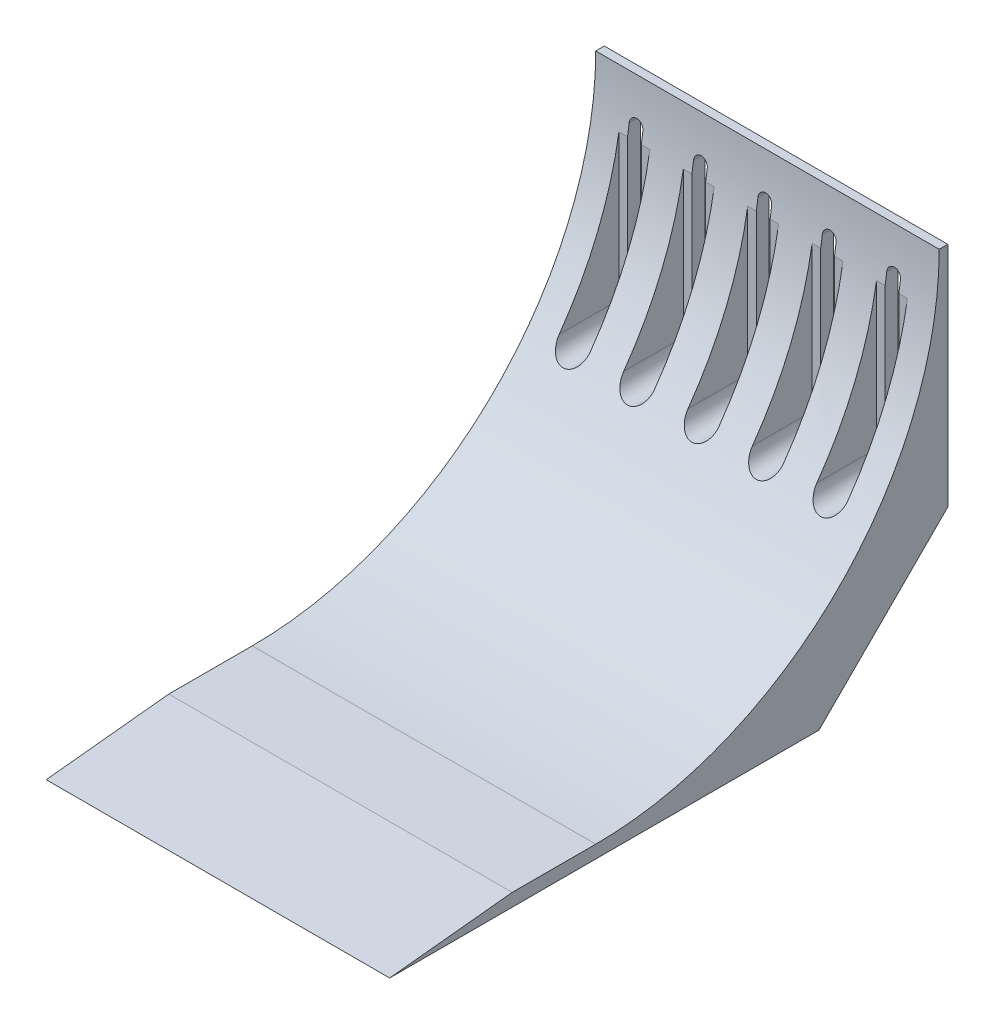
from build123d import *

# Parameters (mm, degrees)
SKETCH1_W           = 80
SKETCH1_H           = 130
BOSS_EXTRUDE1_DEPTH = 3
SKETCH2_W           = 80
SKETCH2_H           = 2
BOSS_EXTRUDE2_DEPTH = 80
FILLET1_DEPTH       = 80
CUT_EXTRUDE1_DEPTH  = 174.749820144
CUT_EXTRUDE2_START  = -3
CUT_EXTRUDE2_DEPTH  = 171.749820238
CHAMFER1_SIZE2      = 28.543093363
CHAMFER1_SIZE       = 3
CHAMFER2_SIZE       = 30


with BuildPart() as part:
    # Sketch1 → Boss-Extrude1 (new body)
    with BuildSketch(Plane(origin=(0, 0, 0), x_dir=(1, 0, 0), z_dir=(0, 1, 0))):
        with Locations((40, 65)):
            Rectangle(SKETCH1_W, SKETCH1_H)
    extrude(amount=BOSS_EXTRUDE1_DEPTH)

    # Sketch2 → Boss-Extrude2 (add)
    with BuildSketch(Plane(origin=(0, 3, 0), x_dir=(1, 0, 0), z_dir=(0, 1, 0))):
        with Locations((40, 129)):
            Rectangle(SKETCH2_W, SKETCH2_H)
    extrude(amount=BOSS_EXTRUDE2_DEPTH)

    # Fillet1: read off the stored shape, not the designer's step
    # Fillet1 outline → Fillet1 (add)
    with BuildSketch(Plane.YZ):
        with BuildLine():
            Line((3, -128), (83, -128))
            ThreePointArc((83, -128), (26.431457505, -104.568542495), (3, -48))
            Line((3, -48), (3, -128))
        make_face()
    extrude(amount=FILLET1_DEPTH)

    # Sketch3 → Cut-Extrude1 (cut, through all)
    with BuildSketch(Plane(origin=(0, 0, -130), x_dir=(-1, 0, 0), z_dir=(0, 0, -1))):
        with BuildLine():
            Line((-38.4, 73), (-38.4, 36.5))
            ThreePointArc((-38.4, 36.5), (-40, 34.9), (-41.6, 36.5))
            Line((-41.6, 36.5), (-41.6, 73))
            ThreePointArc((-41.6, 73), (-40, 74.6), (-38.4, 73))
        make_face()
        with BuildLine():
            Line((-53.4, 73), (-53.4, 36.5))
            ThreePointArc((-53.4, 36.5), (-55, 34.9), (-56.6, 36.5))
            Line((-56.6, 36.5), (-56.6, 73))
            ThreePointArc((-56.6, 73), (-55, 74.6), (-53.4, 73))
        make_face()
        with BuildLine():
            Line((-71.6, 36.5), (-71.6, 73))
            ThreePointArc((-71.6, 73), (-70, 74.6), (-68.4, 73))
            Line((-68.4, 73), (-68.4, 36.5))
            ThreePointArc((-68.4, 36.5), (-70, 34.9), (-71.6, 36.5))
        make_face()
        with BuildLine():
            Line((-23.4, 73), (-23.4, 36.5))
            ThreePointArc((-23.4, 36.5), (-25, 34.9), (-26.6, 36.5))
            Line((-26.6, 36.5), (-26.6, 73))
            ThreePointArc((-26.6, 73), (-25, 74.6), (-23.4, 73))
        make_face()
        with BuildLine():
            Line((-11.6, 36.5), (-11.6, 73))
            ThreePointArc((-11.6, 73), (-10, 74.6), (-8.4, 73))
            Line((-8.4, 73), (-8.4, 36.5))
            ThreePointArc((-8.4, 36.5), (-10, 34.9), (-11.6, 36.5))
        make_face()
    extrude(amount=-CUT_EXTRUDE1_DEPTH, mode=Mode.SUBTRACT)

    # Sketch4 → Cut-Extrude2 (cut, through all)
    with BuildSketch(Plane(origin=(0, 0, -130), x_dir=(-1, 0, 0), z_dir=(0, 0, -1)).offset(CUT_EXTRUDE2_START)):
        with BuildLine():
            Line((-66.4, 73), (-66.4, 36.5))
            ThreePointArc((-66.4, 36.5), (-70, 32.9), (-73.6, 36.5))
            Line((-73.6, 36.5), (-73.6, 73))
            ThreePointArc((-73.6, 73), (-70, 76.6), (-66.4, 73))
        make_face()
        with BuildLine():
            Line((-51.4, 73), (-51.4, 36.5))
            ThreePointArc((-51.4, 36.5), (-55, 32.9), (-58.6, 36.5))
            Line((-58.6, 36.5), (-58.6, 73))
            ThreePointArc((-58.6, 73), (-55, 76.6), (-51.4, 73))
        make_face()
        with BuildLine():
            Line((-43.6, 36.5), (-43.6, 73))
            ThreePointArc((-43.6, 73), (-40, 76.6), (-36.4, 73))
            Line((-36.4, 73), (-36.4, 36.5))
            ThreePointArc((-36.4, 36.5), (-40, 32.9), (-43.6, 36.5))
        make_face()
        with BuildLine():
            Line((-21.4, 73), (-21.4, 36.5))
            ThreePointArc((-21.4, 36.5), (-25, 32.9), (-28.6, 36.5))
            Line((-28.6, 36.5), (-28.6, 73))
            ThreePointArc((-28.6, 73), (-25, 76.6), (-21.4, 73))
        make_face()
        with BuildLine():
            Line((-13.6, 36.5), (-13.6, 73))
            ThreePointArc((-13.6, 73), (-10, 76.6), (-6.4, 73))
            Line((-6.4, 73), (-6.4, 36.5))
            ThreePointArc((-6.4, 36.5), (-10, 32.9), (-13.6, 36.5))
        make_face()
    extrude(amount=-CUT_EXTRUDE2_DEPTH, mode=Mode.SUBTRACT)

    # Chamfer1
    chamfer1_edges = [part.edges().sort_by_distance(p)[0] for p in [
        (40, 3, 0),
    ]]
    chamfer1_side = [part.faces().sort_by_distance(p)[0] for p in [
        (40, 2.94, 0),
    ]]
    chamfer(chamfer1_edges, length=CHAMFER1_SIZE - 0.0001, length2=CHAMFER1_SIZE2 - 0.0001, reference=chamfer1_side[0])  # a hair under: the kernel refuses the full size

    # Chamfer2
    chamfer2_edges = [part.edges().sort_by_distance(p)[0] for p in [
        (40, 0, -130),
    ]]
    chamfer(chamfer2_edges, length=CHAMFER2_SIZE)


solid = part.part
